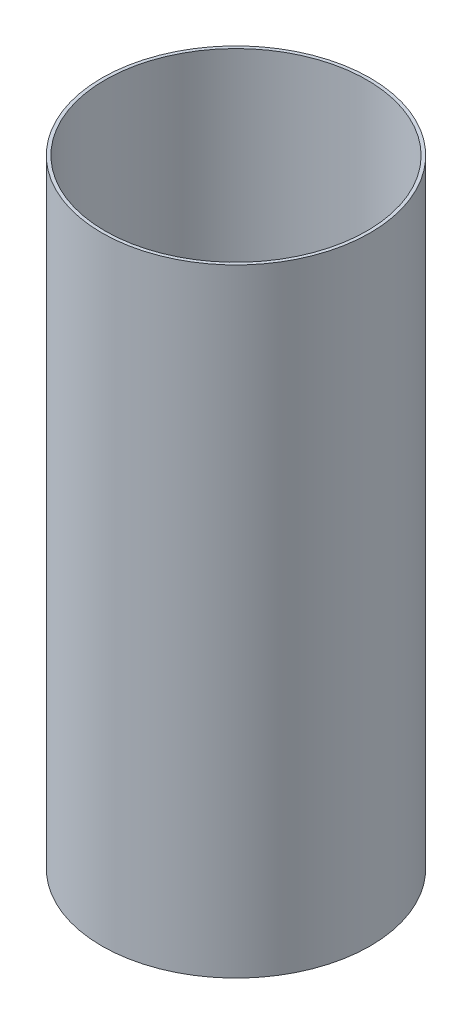
from build123d import *

# Parameters (mm, degrees)
SKETCH1_R           = 82.55
SKETCH1_R_2         = 76.55
BOSS_EXTRUDE1_DEPTH = 380
SKETCH2_R           = 80.55
CUT_EXTRUDE1_DEPTH  = 170
CUT_EXTRUDE2_START  = -155
SKETCH3_R           = 80.55
CUT_EXTRUDE2_DEPTH  = 155


with BuildPart() as part:
    # Sketch1 → Boss-Extrude1 (new body)
    with BuildSketch(Plane(origin=(0, 0, 0), x_dir=(1, 0, 0), z_dir=(0, 1, 0))):
        Circle(SKETCH1_R)
        Circle(SKETCH1_R_2, mode=Mode.SUBTRACT)
    extrude(amount=BOSS_EXTRUDE1_DEPTH)

    # Sketch2 → Cut-Extrude1 (cut)
    with BuildSketch(Plane.XZ):
        Circle(SKETCH2_R)
    extrude(amount=-CUT_EXTRUDE1_DEPTH, mode=Mode.SUBTRACT)

    # Sketch3 → Cut-Extrude2 (cut)
    with BuildSketch(Plane(origin=(0, 380, 0), x_dir=(1, 0, 0), z_dir=(0, 1, 0)).offset(CUT_EXTRUDE2_START)):
        Circle(SKETCH3_R)
    extrude(amount=CUT_EXTRUDE2_DEPTH, mode=Mode.SUBTRACT)


solid = part.part
